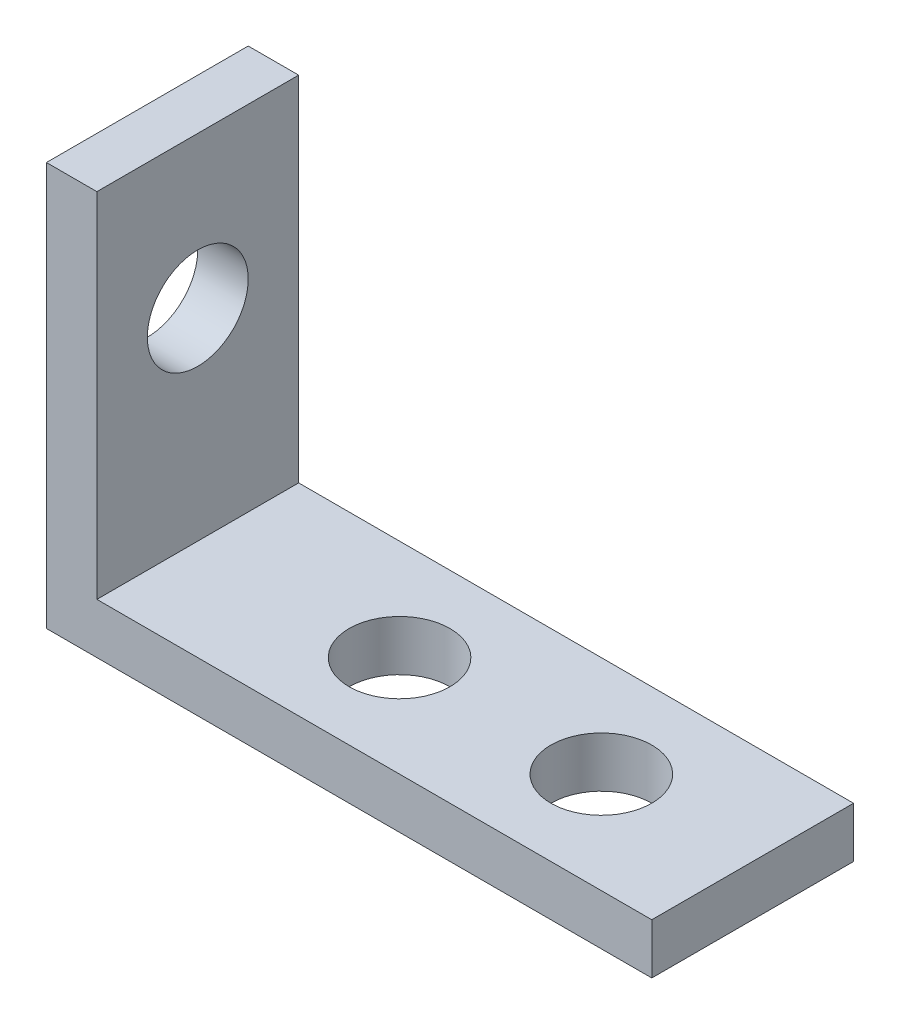
from build123d import *

# Parameters (mm, degrees)
BOSS_EXTRUDE1_DEPTH = 12.7
SKETCH2_R           = 3.175
CUT_EXTRUDE1_DEPTH  = 46.900442536
SKETCH3_R           = 3.175
CUT_EXTRUDE2_DEPTH  = 46.01339384


with BuildPart() as part:
    # Sketch1 → Boss-Extrude1 (new body)
    with BuildSketch(Plane.XY):
        Polygon((0, 0), (0, 25.4), (3.175, 25.4), (3.175, 3.175), (38.1, 3.175), (38.1, 0), align=None)
    extrude(amount=BOSS_EXTRUDE1_DEPTH)

    # Sketch2 → Cut-Extrude1 (cut, through all)
    with BuildSketch(Plane(origin=(0, 3.175, 0), x_dir=(1, 0, 0), z_dir=(0, 1, 0))):
        with Locations((15.875, -6.35)):
            Circle(SKETCH2_R)
        with Locations((28.575, -6.35)):
            Circle(SKETCH2_R)
    extrude(amount=-CUT_EXTRUDE1_DEPTH, mode=Mode.SUBTRACT)

    # Sketch3 → Cut-Extrude2 (cut, through all)
    with BuildSketch(Plane(origin=(3.175, 0, 0), x_dir=(0, 0, -1), z_dir=(1, 0, 0))):
        with Locations((-6.35, 28.575)):
            Circle(SKETCH3_R)
        with Locations((-6.35, 15.875)):
            Circle(SKETCH3_R)
    extrude(amount=-CUT_EXTRUDE2_DEPTH, mode=Mode.SUBTRACT)


solid = part.part
